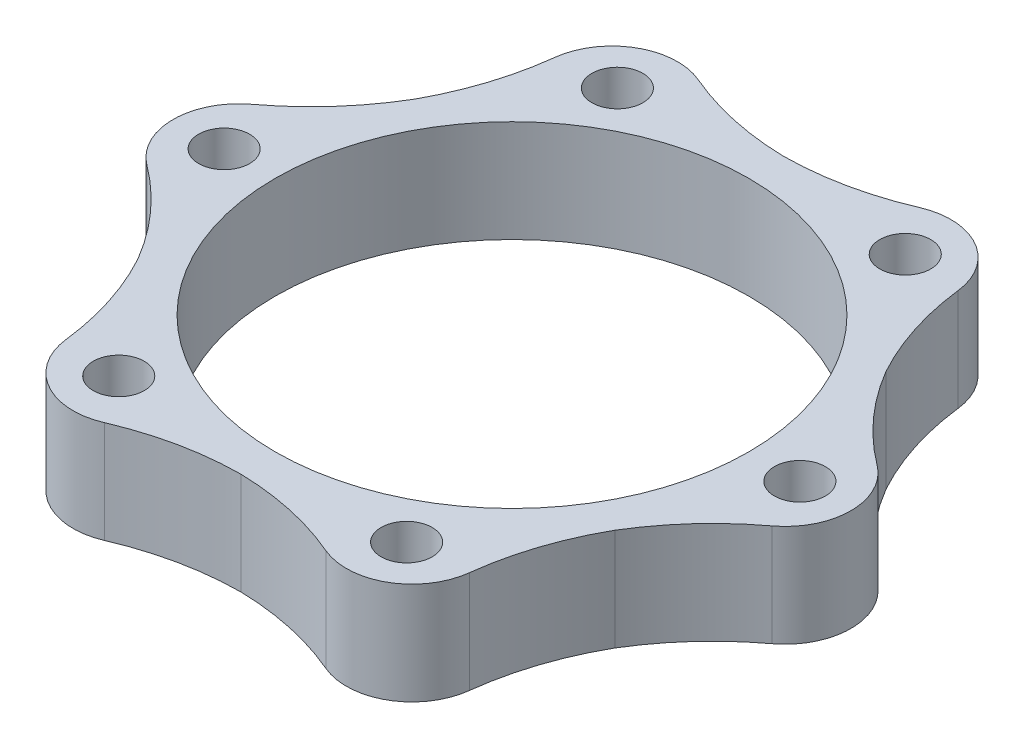
from build123d import *

# Parameters (mm, degrees)
SKETCH1_R           = 23.8125
SKETCH1_R_2         = 20.6375
BOSS_EXTRUDE1_DEPTH = 8.89
BOSS_EXTRUDE2_START = -8.89
BOSS_EXTRUDE2_DEPTH = 8.89
FILLET1_R           = 25.4
CIRPATTERN1_DEPTH   = 8.89
SKETCH3_R           = 2.2225
CUT_EXTRUDE1_DEPTH  = 41.553113931
CIRPATTERN2_COUNT   = 6


# Read off the part's stored shape, not the designer's step: CirPattern1
with BuildPart() as part:
    # Sketch1 → Boss-Extrude1 (new body)
    with BuildSketch(Plane(origin=(0, 0, 0), x_dir=(1, 0, 0), z_dir=(0, 1, 0))):
        with Locations(Location((0, 0, 0), (0, 0, 270))):
            Circle(SKETCH1_R)
        with Locations(Location((0, 0, 0), (0, 0, 270))):
            Circle(SKETCH1_R_2, mode=Mode.SUBTRACT)
    extrude(amount=BOSS_EXTRUDE1_DEPTH)

    # Sketch2 → Boss-Extrude2 (add)
    with BuildSketch(Plane(origin=(0, 8.89, 0), x_dir=(1, 0, 0), z_dir=(0, 1, 0)).offset(BOSS_EXTRUDE2_START)):
        with BuildLine():
            ThreePointArc((-23.1267, 5.673702791), (-29.5275, 0), (-23.1267, -5.673702791))
            ThreePointArc((-23.1267, -5.673702791), (-23.8125, 0), (-23.1267, 5.673702791))
        make_face()
    extrude(amount=BOSS_EXTRUDE2_DEPTH)

    # Fillet1
    fillet1_edges = [part.edges().sort_by_distance(p)[0] for p in [
        (-23.1267, 4.445, -5.673702791),
        (-23.1267, 4.445, 5.673702791),
    ]]
    fillet(fillet1_edges, radius=FILLET1_R)

    # CirPattern1 outline → CirPattern1 (add)
    with BuildSketch(Plane(origin=(0, 0, 0), x_dir=(1, 0, 0), z_dir=(0, 1, 0))):
        with BuildLine():
            ThreePointArc((-20.530983871, -12.062912482), (-18.612348128, -16.535370154), (-17.581908256, -21.29165383))
            ThreePointArc((-17.581908256, -21.29165383), (-14.764885819, -25.570909171), (-9.650569001, -25.873242043))
            ThreePointArc((-9.650569001, -25.873242043), (-4.837563965, -24.35161844), (0.181296717, -23.811809838))
            ThreePointArc((0.181296717, -23.811809838), (-11.748897356, -20.712280588), (-20.530983871, -12.062912482))
        make_face()
        with BuildLine():
            ThreePointArc((-20.530983871, 12.062912482), (-11.90625, 20.622229928), (-0.181296717, 23.811809838))
            ThreePointArc((-0.181296717, 23.811809838), (-5.01387655, 24.38645138), (-9.648158978, 25.872206112))
            ThreePointArc((-9.648158978, 25.872206112), (-14.76375, 25.57156511), (-17.581908256, 21.29165383))
            ThreePointArc((-17.581908256, 21.29165383), (-18.612348128, 16.535370154), (-20.530983871, 12.062912482))
        make_face()
        with BuildLine():
            ThreePointArc((-0.181296717, 23.811809838), (11.748897356, 20.712280588), (20.530983871, 12.062912482))
            ThreePointArc((20.530983871, 12.062912482), (18.612348128, 16.535370154), (17.581908256, 21.29165383))
            ThreePointArc((17.581908256, 21.29165383), (14.764885819, 25.570909171), (9.650569001, 25.873242043))
            ThreePointArc((9.650569001, 25.873242043), (4.837563965, 24.35161844), (-0.181296717, 23.811809838))
        make_face()
        with BuildLine():
            ThreePointArc((20.530983871, 12.062912482), (23.811809838, 0.181296717), (20.712280588, -11.748897356))
            ThreePointArc((20.712280588, -11.748897356), (23.626224678, -7.851081226), (27.230067234, -4.580552281))
            ThreePointArc((27.230067234, -4.580552281), (29.527499849, -0.001311618), (27.232169388, 4.578983105))
            ThreePointArc((27.232169388, 4.578983105), (23.507902174, 7.986355934), (20.530983871, 12.062912482))
        make_face()
        with BuildLine():
            ThreePointArc((20.712280588, -11.748897356), (12.062912482, -20.530983871), (0.181296717, -23.811809838))
            ThreePointArc((0.181296717, -23.811809838), (5.01387655, -24.38645138), (9.648158978, -25.872206112))
            ThreePointArc((9.648158978, -25.872206112), (14.762614031, -25.572220789), (17.581600387, -21.294258937))
            ThreePointArc((17.581600387, -21.294258937), (18.67033821, -16.365262506), (20.712280588, -11.748897356))
        make_face()
    extrude(amount=CIRPATTERN1_DEPTH)

    # Sketch3 → Cut-Extrude1 (cut, symmetric)
    with BuildSketch(Plane(origin=(0, 8.89, 0), x_dir=(1, 0, 0), z_dir=(0, 1, 0))):
        with Locations(Location((-25.0825, 0, 0), (0, 0, 270))):
            Circle(SKETCH3_R)
    cut_extrude1 = extrude(amount=CUT_EXTRUDE1_DEPTH, both=True, mode=Mode.SUBTRACT)

    # CirPattern2: Cut-Extrude1 ×6 about axis
    cirpattern2_axis = Axis((0, 0, 0), (0, 1, 0))
    for i in range(1, CIRPATTERN2_COUNT):
        add(cut_extrude1.rotate(cirpattern2_axis, i * 360 / CIRPATTERN2_COUNT), mode=Mode.SUBTRACT)


solid = part.part
